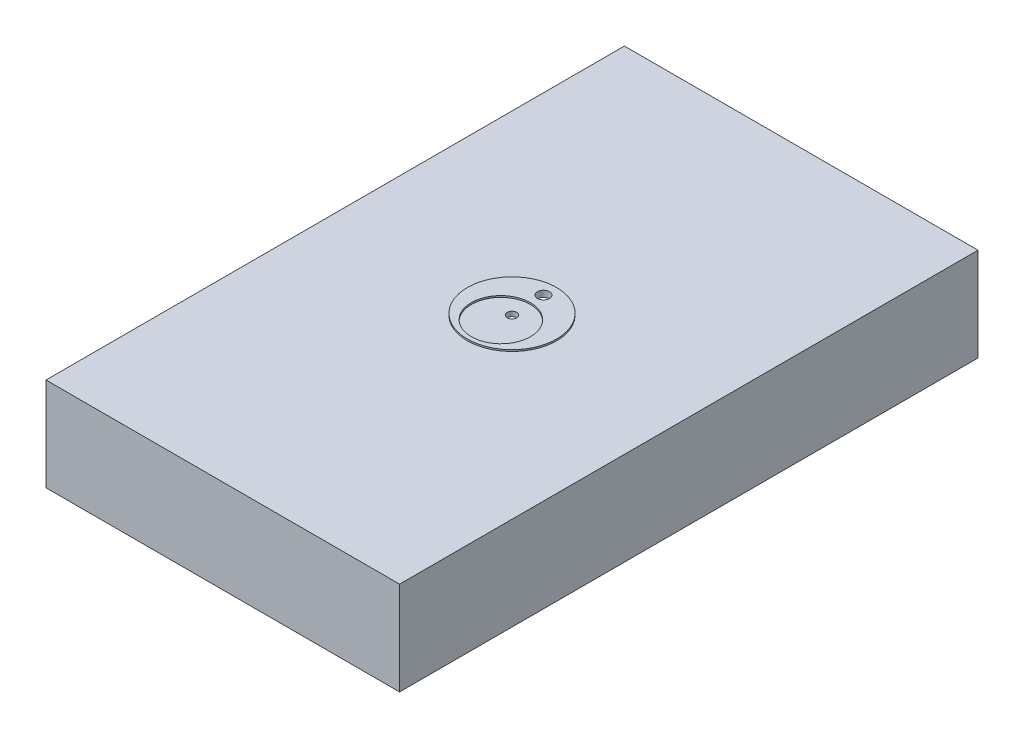
from build123d import *

# Parameters (mm, degrees)
SKETCH1_R           = 28.1
BOSS_EXTRUDE1_DEPTH = 1
SKETCH2_R           = 18.6
CUT_EXTRUDE1_DEPTH  = 58.8
SKETCH3_W           = 222.683092022
SKETCH3_H           = 364.2827524
BOSS_EXTRUDE2_DEPTH = 58.8
SKETCH4_W           = 207.917403516
SKETCH4_H           = 348.54429772
CUT_EXTRUDE2_DEPTH  = 55.8
SKETCH10_R          = 3.75
CUT_EXTRUDE9_DEPTH  = 10
SKETCH11_R          = 3
CUT_EXTRUDE10_DEPTH = 10


with BuildPart() as part:
    # Sketch1 → Boss-Extrude1 (new body)
    with BuildSketch(Plane(origin=(0, 0, 0), x_dir=(1, 0, 0), z_dir=(0, 1, 0))):
        Circle(SKETCH1_R)
    extrude(amount=BOSS_EXTRUDE1_DEPTH)

    # Sketch2 → Cut-Extrude1 (cut)
    with BuildSketch(Plane(origin=(0, 1, 0), x_dir=(1, 0, 0), z_dir=(0, 1, 0))):
        with Locations((0, -7)):
            Circle(SKETCH2_R)
    extrude(amount=-CUT_EXTRUDE1_DEPTH, mode=Mode.SUBTRACT)

    # Sketch3 → Boss-Extrude2 (add)
    with BuildSketch(Plane(origin=(0, 0, 0), x_dir=(-1, 0, 0), z_dir=(0, -1, 0))):
        Rectangle(SKETCH3_W, SKETCH3_H)
    extrude(amount=BOSS_EXTRUDE2_DEPTH)

    # Sketch4 → Cut-Extrude2 (cut)
    with BuildSketch(Plane(origin=(0, -58.8, 0), x_dir=(-1, 0, 0), z_dir=(0, -1, 0))):
        Rectangle(SKETCH4_W, SKETCH4_H)
    extrude(amount=-CUT_EXTRUDE2_DEPTH, mode=Mode.SUBTRACT)

    # Sketch10 → Cut-Extrude9 (cut)
    with BuildSketch(Plane(origin=(0, 1, 0), x_dir=(1, 0, 0), z_dir=(0, 1, 0))):
        with Locations((0, 19.85)):
            Circle(SKETCH10_R)
    extrude(amount=-CUT_EXTRUDE9_DEPTH, mode=Mode.SUBTRACT)

    # Sketch11 → Cut-Extrude10 (cut)
    with BuildSketch(Plane(origin=(0, 1, 0), x_dir=(1, 0, 0), z_dir=(0, 1, 0))):
        Circle(SKETCH11_R)
    extrude(amount=-CUT_EXTRUDE10_DEPTH, mode=Mode.SUBTRACT)


solid = part.part
